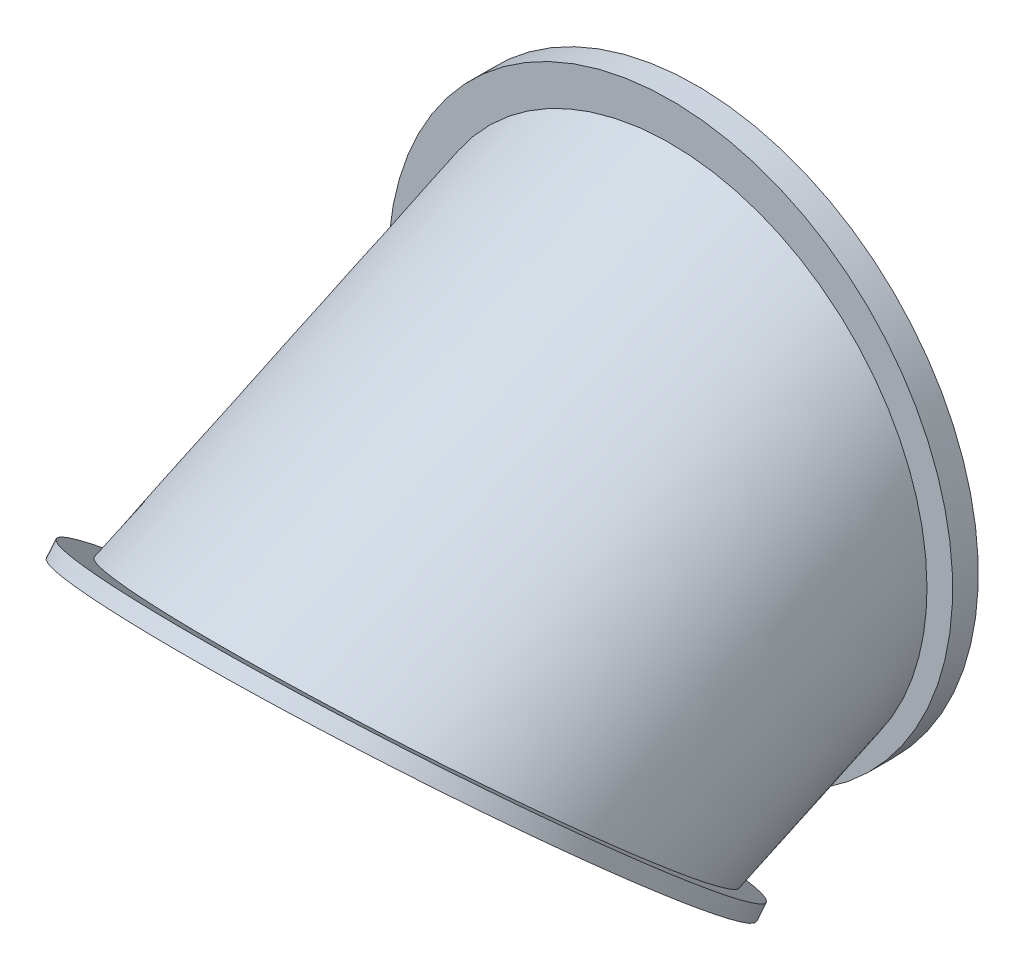
from build123d import *

# Parameters (mm, degrees)
SKETCH1_R           = 50
SKETCH9_R           = 55
BOSS_EXTRUDE3_DEPTH = 5
SKETCH11_R          = 54.999999864
BOSS_EXTRUDE2_DEPTH = 3
CUT_EXTRUDE1_START  = -51.42835335
CUT_EXTRUDE1_DEPTH  = 102.8567067


with BuildPart() as part:
    # Sweep1: sweep along a path in Sketch3
    with BuildLine(Plane(origin=(0, 0, 0), x_dir=(0, 0, -1), z_dir=(1, 0, 0))) as sweep1_path:
        Line((0, 0), (-108.756934444, -50.714191409))
    # Sketch1 → Sweep1 (sweep)
    with BuildSketch(Plane.XY):
        Circle(SKETCH1_R)
    sweep(path=sweep1_path.line)

    # SurfaceCut3
    split(bisect_by=Plane(origin=(0, -44.011806663, 36.930290738), x_dir=(1, 0, 0), z_dir=(0, -0.7660444431189792, 0.6427876096865379)), keep=Keep.BOTTOM)

    # Sketch9 → Boss-Extrude3 (add)
    with BuildSketch(Plane(origin=(0, 0, 0), x_dir=(-1, 0, 0), z_dir=(0, 0, -1))):
        Circle(SKETCH9_R)
    extrude(amount=-BOSS_EXTRUDE3_DEPTH)

    # Sketch11 → Boss-Extrude2 (add)
    with BuildSketch(Plane(origin=(0, -44.011806663, 36.930290738), x_dir=(1, 0, 0), z_dir=(0, -0.7660444431189792, 0.6427876096865379))):
        with Locations(Location((0, 26.790929274, 0), (0, 0, 270))):
            Circle(SKETCH11_R)
    extrude(amount=-BOSS_EXTRUDE2_DEPTH)

    # Cut-Extrude1: read off the stored shape, not the designer's step
    # Cut-Extrude1 outline → Cut-Extrude1 (cut)
    with BuildSketch(Plane(origin=(0, -13.395464637, 28.726666617), x_dir=(1, 0, 0), z_dir=(0, -0.4226182617406939, 0.9063077870366526)).offset(CUT_EXTRUDE1_START)):
        with BuildLine():
            add(Edge.make_bspline(
                [(47, 0), (47, 5.498398611), (44.591576679, 16.495195833), (34.22212763, 30.585706168), (18.564174342, 40.081512496), (0, 43.43232778), (-18.564174342, 40.081512496), (-34.22212763, 30.585706168), (-44.591576679, 16.495195833), (-48.20421166, 0), (-44.591576679, -16.495195833), (-34.22212763, -30.585706168), (-18.564174342, -40.081512496), (0, -43.43232778), (18.564174342, -40.081512496), (34.22212763, -30.585706168), (44.591576679, -16.495195833), (47, -5.498398611), (47, 0)],
                knots=[0, 0, 0, 0, 0.392699082, 0.785398163, 1.178097245, 1.570796327, 1.963495408, 2.35619449, 2.748893572, 3.141592654, 3.534291735, 3.926990817, 4.319689899, 4.71238898, 5.105088062, 5.497787144, 5.890486225, 6.283185307, 6.283185307, 6.283185307, 6.283185307], degree=3))
        make_face()
    extrude(amount=CUT_EXTRUDE1_DEPTH, mode=Mode.SUBTRACT)


solid = part.part
